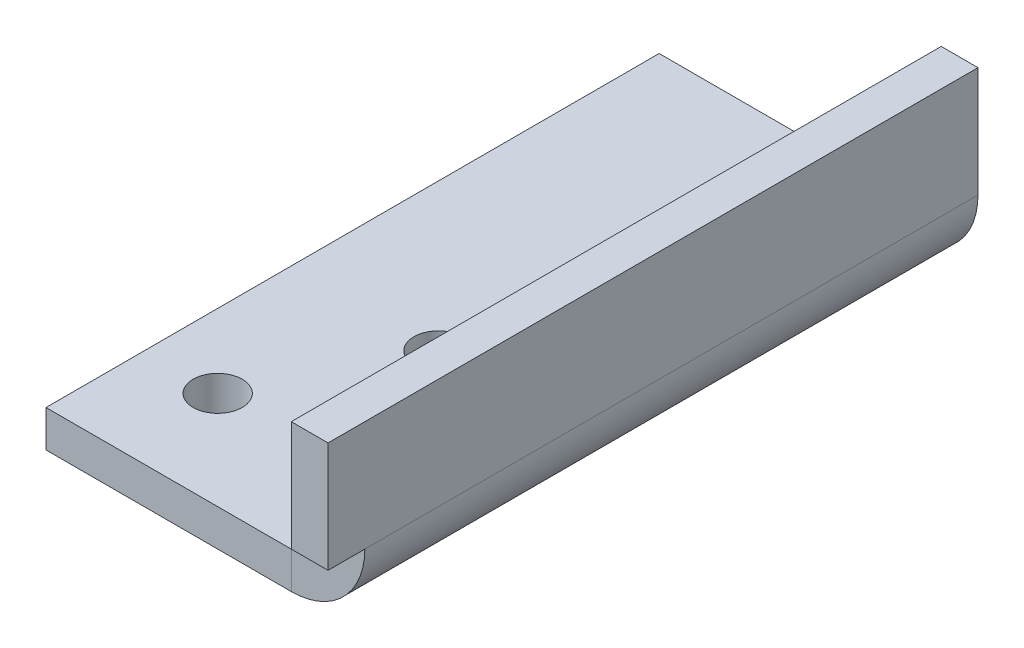
from build123d import *

# Parameters (mm, degrees)
SKETCH1_W               = 20
SKETCH1_H               = 50
SKETCH1_R               = 2
BASE_FLANGE1_DEPTH      = 3
EDGE_FLANGE1_DEPTH      = 50
EDGE_FLANGE1_START      = 3
EDGE_FLANGE1_PROFILE_W  = 53
EDGE_FLANGE1_PROFILE_H  = 9
EDGE_FLANGE1_FLAT_DEPTH = 3


# Sheet-metal steps are written as plain solids
with BuildPart() as part:
    # Sketch1 → Base-Flange1 (new body)
    with BuildSketch(Plane(origin=(0, 0, 0), x_dir=(1, 0, 0), z_dir=(0, 1, 0))):
        Rectangle(SKETCH1_W, SKETCH1_H)
        with Locations(Location((-4, 17, 0), (0, 0, 270))):
            Circle(SKETCH1_R, mode=Mode.SUBTRACT)
        with Locations(Location((2, 5, 0), (0, 0, 270))):
            Circle(SKETCH1_R, mode=Mode.SUBTRACT)
    extrude(amount=-BASE_FLANGE1_DEPTH)

    # Edge-Flange1 bend section (across the edge) → Edge-Flange1 (add)
    with BuildSketch(Plane(origin=(13, 0, 25), x_dir=(-1, 0, 0), z_dir=(0, 0, -1))):
        with BuildLine():
            Line((-3, 3), (0, 3))
            ThreePointArc((0, 3), (0.878679656, 0.878679656), (3, 0))
            Line((3, 0), (3, -3))
            ThreePointArc((3, -3), (-1.242640687, -1.242640687), (-3, 3))
        make_face()
    extrude(amount=EDGE_FLANGE1_DEPTH)

    # Edge-Flange1 profile (on flange) → Edge-Flange1 flat (add)
    with BuildSketch(Plane(origin=(13, 0, 0), x_dir=(0, 0, -1), z_dir=(1, 0, 0)).offset(EDGE_FLANGE1_START)):
        with Locations((1.5, 7.5)):
            Rectangle(EDGE_FLANGE1_PROFILE_W, EDGE_FLANGE1_PROFILE_H)
    extrude(amount=-EDGE_FLANGE1_FLAT_DEPTH)


with BuildPart() as body_2:
    # Mirror1: mirrored copy
    add(part.part.mirror(Plane(origin=(14.5, 7.5, -28), x_dir=(1, 0, 0), z_dir=(0, 0, -1))))


solid = body_2.part
